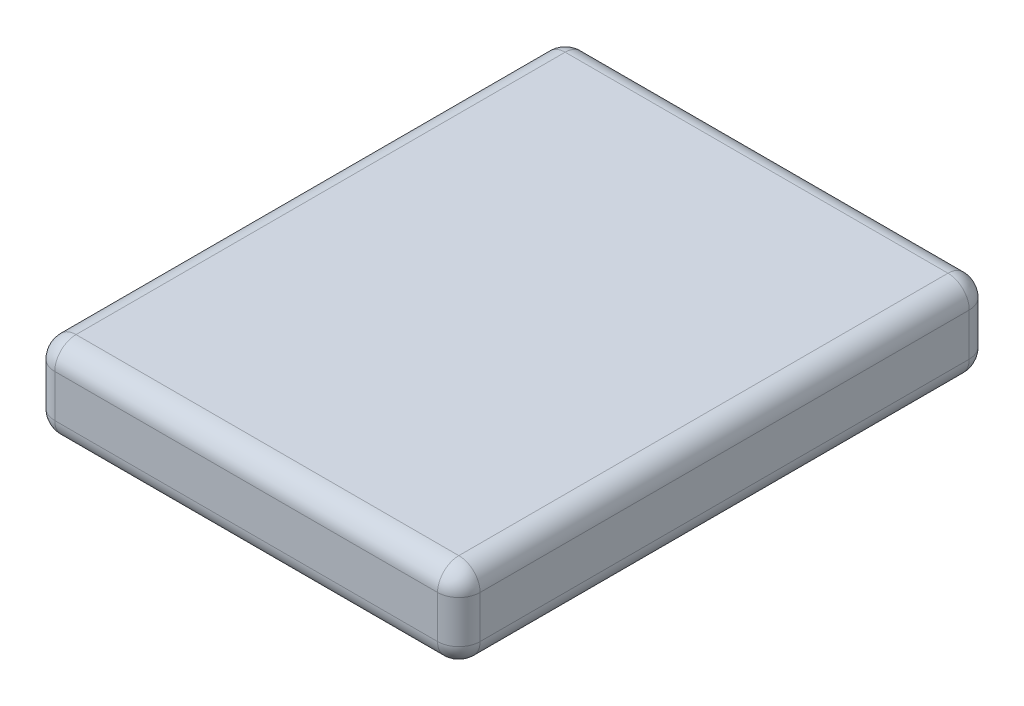
from build123d import *

# Parameters (mm, degrees)
SKETCH_1_W      = 20
SKETCH_1_H      = 25
EXTRUDE_1_DEPTH = 4
FILLET_2_R      = 1
FILLET_3_R      = 1


with BuildPart() as part:
    # 草图1 → 凸台-拉伸1 (new body)
    with BuildSketch(Plane(origin=(0, 0, 0), x_dir=(1, 0, 0), z_dir=(0, 1, 0))):
        Rectangle(SKETCH_1_W, SKETCH_1_H)
    extrude(amount=EXTRUDE_1_DEPTH)

    # 圆角2
    fillet_2_edges = [part.edges().sort_by_distance(p)[0] for p in [
        (-10, 4, 0),
        (0, 0, 12.5),
        (-10, 0, 0),
        (0, 0, -12.5),
        (10, 0, 0),
        (-10, 2, 12.5),
        (-10, 2, -12.5),
    ]]
    fillet(fillet_2_edges, radius=FILLET_2_R)

    # 圆角3
    # the kernel refuses this fillet: 1 mm, written as the material it takes off along each edge
    with BuildSketch(Plane(origin=(-9, 3, 11.5), x_dir=(0, 0, 1), z_dir=(0, 1, 0))) as fillet_3_piece_1_section:
        Polygon((0, 0), (FILLET_3_R, 0), (FILLET_3_R, -FILLET_3_R), (0, -FILLET_3_R), align=None)
    fillet_3_piece_1 = extrude(amount=FILLET_3_R, mode=Mode.PRIVATE)
    fillet_3_piece_1 = fillet_3_piece_1 - Plane(origin=(-9, 3, 11.5), x_dir=(0.7071067811865475, 0, -0.7071067811865477), z_dir=(0, 1, 0)) * Sphere(FILLET_3_R, mode=Mode.PRIVATE)
    add(fillet_3_piece_1, mode=Mode.SUBTRACT)
    with BuildSketch(Plane(origin=(-9, 3, -11.5), x_dir=(0, 1, 0), z_dir=(0, 0, -1))) as fillet_3_piece_2_section:
        Polygon((0, 0), (FILLET_3_R, 0), (FILLET_3_R, -FILLET_3_R), (0, -FILLET_3_R), align=None)
    fillet_3_piece_2 = extrude(amount=FILLET_3_R, mode=Mode.PRIVATE)
    fillet_3_piece_2 = fillet_3_piece_2 - Plane(origin=(-9, 3, -11.5), x_dir=(0.7071067811865475, -0.7071067811865475, 0), z_dir=(0, 0, -1)) * Sphere(FILLET_3_R, mode=Mode.PRIVATE)
    add(fillet_3_piece_2, mode=Mode.SUBTRACT)
    with BuildSketch(Plane(origin=(9, 1, 11.5), x_dir=(0, 0, 1), z_dir=(1, 0, 0))) as fillet_3_piece_3_section:
        Polygon((0, 0), (FILLET_3_R, 0), (FILLET_3_R, FILLET_3_R), (0, FILLET_3_R), align=None)
    fillet_3_piece_3 = extrude(amount=FILLET_3_R, mode=Mode.PRIVATE)
    fillet_3_piece_3 = fillet_3_piece_3 - Plane(origin=(9, 1, 11.5), x_dir=(0, 0.7071067811865475, -0.7071067811865475), z_dir=(1, 0, 0)) * Sphere(FILLET_3_R, mode=Mode.PRIVATE)
    add(fillet_3_piece_3, mode=Mode.SUBTRACT)
    with BuildSketch(Plane(origin=(9, 1, -11.5), x_dir=(1, 0, 0), z_dir=(0, 0, -1))) as fillet_3_piece_4_section:
        Polygon((0, 0), (FILLET_3_R, 0), (FILLET_3_R, FILLET_3_R), (0, FILLET_3_R), align=None)
    fillet_3_piece_4 = extrude(amount=FILLET_3_R, mode=Mode.PRIVATE)
    fillet_3_piece_4 = fillet_3_piece_4 - Plane(origin=(9, 1, -11.5), x_dir=(-0.7071067811865475, 0.7071067811865475, 0), z_dir=(0, 0, -1)) * Sphere(FILLET_3_R, mode=Mode.PRIVATE)
    add(fillet_3_piece_4, mode=Mode.SUBTRACT)
    with BuildSketch(Plane(origin=(9, 3, 11.5), x_dir=(0, 1, 0), z_dir=(1, 0, 0))) as fillet_3_piece_5_section:
        Polygon((0, 0), (FILLET_3_R, 0), (FILLET_3_R, FILLET_3_R), (0, FILLET_3_R), align=None)
    fillet_3_piece_5 = extrude(amount=FILLET_3_R, mode=Mode.PRIVATE)
    fillet_3_piece_5 = fillet_3_piece_5 - Plane(origin=(9, 3, 11.5), x_dir=(0, -0.7071067811865475, -0.7071067811865475), z_dir=(1, 0, 0)) * Sphere(FILLET_3_R, mode=Mode.PRIVATE)
    add(fillet_3_piece_5, mode=Mode.SUBTRACT)
    with BuildSketch(Plane(origin=(9, 3, -11.5), x_dir=(1, 0, 0), z_dir=(0, 0, -1))) as fillet_3_piece_6_section:
        Polygon((0, 0), (FILLET_3_R, 0), (FILLET_3_R, -FILLET_3_R), (0, -FILLET_3_R), align=None)
    fillet_3_piece_6 = extrude(amount=FILLET_3_R, mode=Mode.PRIVATE)
    fillet_3_piece_6 = fillet_3_piece_6 - Plane(origin=(9, 3, -11.5), x_dir=(-0.7071067811865475, -0.7071067811865475, 0), z_dir=(0, 0, -1)) * Sphere(FILLET_3_R, mode=Mode.PRIVATE)
    add(fillet_3_piece_6, mode=Mode.SUBTRACT)
    with BuildSketch(Plane(origin=(9, 4, 12.5), x_dir=(0, 0, -1), z_dir=(-1, 0, 0))) as fillet_3_piece_7:
        with BuildLine():
            CenterArc((FILLET_3_R, FILLET_3_R), FILLET_3_R, 180, 90)
            Line((0, FILLET_3_R), (0, 0))
            Line((0, 0), (FILLET_3_R, 0))
        make_face()
    extrude(amount=18, mode=Mode.SUBTRACT)
    with BuildSketch(Plane(origin=(10, 4, -11.5), x_dir=(0, -1, 0), z_dir=(0, 0, 1))) as fillet_3_piece_8:
        with BuildLine():
            CenterArc((FILLET_3_R, -FILLET_3_R), FILLET_3_R, 90, 90)
            Line((0, -FILLET_3_R), (0, 0))
            Line((0, 0), (FILLET_3_R, 0))
        make_face()
    extrude(amount=23, mode=Mode.SUBTRACT)
    with BuildSketch(Plane(origin=(-9, 4, -12.5), x_dir=(0, -1, 0), z_dir=(1, 0, 0))) as fillet_3_piece_9:
        with BuildLine():
            CenterArc((FILLET_3_R, -FILLET_3_R), FILLET_3_R, 90, 90)
            Line((0, -FILLET_3_R), (0, 0))
            Line((0, 0), (FILLET_3_R, 0))
        make_face()
    extrude(amount=18, mode=Mode.SUBTRACT)
    with BuildSketch(Plane(origin=(10, 1, 12.5), x_dir=(0, 0, -1), z_dir=(0, 1, 0)), Plane(origin=(10, 1, -12.5), x_dir=(-1, 0, 0), z_dir=(0, 1, 0))) as fillet_3_piece_10:
        with BuildLine():
            CenterArc((FILLET_3_R, FILLET_3_R), FILLET_3_R, 180, 90)
            Line((0, FILLET_3_R), (0, 0))
            Line((0, 0), (FILLET_3_R, 0))
        make_face()
    extrude(amount=2, mode=Mode.SUBTRACT)


solid = part.part
